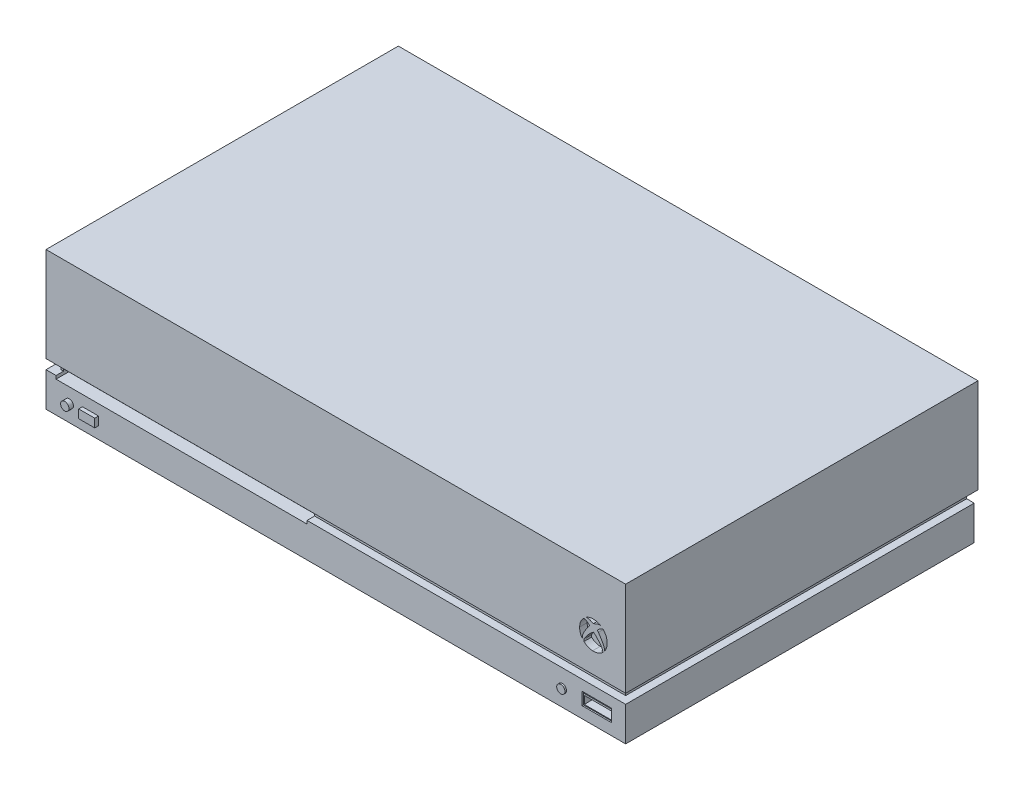
from build123d import *

# Parameters (mm, degrees)
SKETCH1_W                = 212.107853024
SKETCH1_H                = 117.102309081
BOSS_EXTRUDE1_DEPTH      = 31.75
SKETCH2_W                = 194.732937393
SKETCH2_H                = 117.102309081
BOSS_EXTRUDE2_DEPTH      = 14.732
SKETCH3_W                = 194.732937393
SKETCH3_H                = 3.216168398
CUT_EXTRUDE1_DEPTH       = 2.54
SKETCH4_W                = 117.102309081
SKETCH4_H                = 3.216168398
CUT_EXTRUDE2_DEPTH       = 2.54
SKETCH5_W                = 194.732937393
SKETCH5_H                = 3.216168398
CUT_EXTRUDE4_DEPTH       = 2.54
SKETCH6_W                = 112.022309081
SKETCH6_H                = 3.216168398
CUT_EXTRUDE6_DEPTH       = 2.54
SKETCH7_W                = 9.800841368
SKETCH7_H                = 4.210890985
CUT_EXTRUDE8_DEPTH       = 5.08
SKETCH8_W                = 9.800841368
SKETCH8_H                = 4.210890985
BOSS_EXTRUDE3_DEPTH      = 4.631427663
SKETCH9_W                = 9.384665973
SKETCH9_H                = 2.632296742
CUT_EXTRUDE9_DEPTH       = 4.631427663
SKETCH10_W               = 9.800841368
SKETCH10_H               = 0.718754899
CUT_EXTRUDE10_DEPTH      = 4.631427663
SKETCH11_R               = 1.397
BOSS_EXTRUDE4_DEPTH      = 0.508
SKETCH13_R               = 1.397
BOSS_EXTRUDE5_DEPTH      = 1.524
SKETCH14_W               = 84.322597194
SKETCH14_H               = 1.073519387
CUT_EXTRUDE12_DEPTH      = 12.7
SKETCH15_W               = 84.322597194
SKETCH15_H               = 0.3048
CUT_EXTRUDE14_DEPTH      = 10.16
SKETCH17_W               = 5.386365849
SKETCH17_H               = 2.851092169
BOSS_EXTRUDE7_DEPTH      = 1.27
SKETCH19_W               = 9.105647215
SKETCH19_H               = 31.75
CUT_EXTRUDE17_DEPTH      = 133.35
SKETCH20_W               = 84.322597194
SKETCH20_H               = 0.343473221
CUT_EXTRUDE20_DEPTH      = 10.16
SKETCH21_W               = 189.652937393
SKETCH21_H               = 3.216168398
BOSS_EXTRUDE8_DEPTH      = 2.54
BOSS_EXTRUDE9_DEPTH      = 1.27
SKETCH25_R               = 0.951460687
SKETCH25_R_2             = 0.889
CUT_EXTRUDE23_DEPTH      = 13.97
CUT_EXTRUDE28_DEPTH      = 13.97
SKETCH27_W               = 7.363051664
SKETCH27_H               = 3.420256256
CUT_EXTRUDE29_DEPTH      = 13.97
SKETCH28_R               = 3.898786899
SKETCH28_R_2             = 2.556322344
SKETCH28_W               = 12.142531133
SKETCH28_H               = 6.109787609
SKETCH28_W_2             = 8.308047617
SKETCH28_H_2             = 10.526669927
SKETCH28_W_3             = 10.012262514
CUT_EXTRUDE30_DEPTH      = 7.62
SKETCH30_R               = 1.014601812
SKETCH30_R_2             = 1.106611033
SKETCH30_W               = 0.071233975
SKETCH30_H               = 0.79375
BOSS_EXTRUDE10_DEPTH     = 3.81
CUT_EXTRUDE33_DEPTH      = 2.54
CUT_EXTRUDE34_DEPTH      = 130.048
CUT_EXTRUDE34_DEPTH_BACK = 66.548


with BuildPart() as part:
    # Sketch1 → Boss-Extrude1 (new body)
    with BuildSketch(Plane(origin=(0, 0, 0), x_dir=(1, 0, 0), z_dir=(0, 1, 0))):
        with Locations((31.316249479, -18.517517006)):
            Rectangle(SKETCH1_W, SKETCH1_H)
    extrude(amount=BOSS_EXTRUDE1_DEPTH)

    # Sketch2 → Boss-Extrude2 (add)
    with BuildSketch(Plane.XZ):
        with Locations((40.003707294, 18.517517006)):
            Rectangle(SKETCH2_W, SKETCH2_H)
    extrude(amount=BOSS_EXTRUDE2_DEPTH)

    # Sketch3 → Cut-Extrude1 (cut)
    with BuildSketch(Plane.XY.offset(77.068671546)):
        with Locations((40.003707294, -1.608084199)):
            Rectangle(SKETCH3_W, SKETCH3_H)
    extrude(amount=-CUT_EXTRUDE1_DEPTH, mode=Mode.SUBTRACT)

    # Sketch4 → Cut-Extrude2 (cut)
    with BuildSketch(Plane(origin=(137.370175991, 0, 0), x_dir=(0, 0, -1), z_dir=(1, 0, 0))):
        with Locations((-18.517517006, -1.608084199)):
            Rectangle(SKETCH4_W, SKETCH4_H)
    extrude(amount=-CUT_EXTRUDE2_DEPTH, mode=Mode.SUBTRACT)

    # Sketch5 → Cut-Extrude4 (cut)
    with BuildSketch(Plane(origin=(0, 0, -40.033637535), x_dir=(-1, 0, 0), z_dir=(0, 0, -1))):
        with Locations((-40.003707294, -1.608084199)):
            Rectangle(SKETCH5_W, SKETCH5_H)
    extrude(amount=-CUT_EXTRUDE4_DEPTH, mode=Mode.SUBTRACT)

    # Sketch6 → Cut-Extrude6 (cut)
    with BuildSketch(Plane.ZY.offset(57.362761402)):
        with Locations((18.517517005, -1.608084199)):
            Rectangle(SKETCH6_W, SKETCH6_H)
    extrude(amount=-CUT_EXTRUDE6_DEPTH, mode=Mode.SUBTRACT)

    # Sketch7 → Cut-Extrude8 (cut)
    with BuildSketch(Plane.XY.offset(77.068671546)):
        with Locations((127.643755307, -8.816554508)):
            Rectangle(SKETCH7_W, SKETCH7_H)
    extrude(amount=-CUT_EXTRUDE8_DEPTH, mode=Mode.SUBTRACT)

    # Sketch8 → Boss-Extrude3 (add)
    with BuildSketch(Plane.XY.offset(71.988671546)):
        with Locations((127.643755307, -8.816554508)):
            Rectangle(SKETCH8_W, SKETCH8_H)
    extrude(amount=BOSS_EXTRUDE3_DEPTH)

    # Sketch9 → Cut-Extrude9 (cut)
    with BuildSketch(Plane.XY.offset(76.620099209)):
        with Locations((127.71617797, -9.310101698)):
            Rectangle(SKETCH9_W, SKETCH9_H)
    extrude(amount=-CUT_EXTRUDE9_DEPTH, mode=Mode.SUBTRACT)

    # Sketch10 → Cut-Extrude10 (cut)
    with BuildSketch(Plane.XY.offset(76.620099209)):
        with Locations((127.643755307, -7.070486465)):
            Rectangle(SKETCH10_W, SKETCH10_H)
    extrude(amount=-CUT_EXTRUDE10_DEPTH, mode=Mode.SUBTRACT)

    # Sketch11 → Boss-Extrude4 (add)
    with BuildSketch(Plane.XY.offset(77.068671546)):
        with Locations((116.100210308, -9.166079984)):
            Circle(SKETCH11_R)
    extrude(amount=BOSS_EXTRUDE4_DEPTH)

    # Sketch13 → Boss-Extrude5 (add)
    with BuildSketch(Plane.XY.offset(77.068671546)):
        with Locations((-49.539463299, -9.166079984)):
            Circle(SKETCH13_R)
    extrude(amount=BOSS_EXTRUDE5_DEPTH)

    # Sketch14 → Cut-Extrude12 (cut)
    with BuildSketch(Plane.XY.offset(77.068671546)):
        with Locations((-11.829077968, -3.752928092)):
            Rectangle(SKETCH14_W, SKETCH14_H)
    extrude(amount=-CUT_EXTRUDE12_DEPTH, mode=Mode.SUBTRACT)

    # Sketch15 → Cut-Extrude14 (cut)
    with BuildSketch(Plane.XY.offset(74.528671546)):
        with Locations((-11.829077968, -3.063768398)):
            Rectangle(SKETCH15_W, SKETCH15_H)
    extrude(amount=-CUT_EXTRUDE14_DEPTH, mode=Mode.SUBTRACT)

    # Sketch17 → Boss-Extrude7 (add)
    with BuildSketch(Plane.XY.offset(77.068671546)):
        with Locations((-42.420893341, -9.292123727)):
            Rectangle(SKETCH17_W, SKETCH17_H)
    extrude(amount=BOSS_EXTRUDE7_DEPTH)

    # Sketch19 → Cut-Extrude17 (cut)
    with BuildSketch(Plane.XY.offset(77.068671546)):
        with Locations((-70.184853426, 15.875)):
            Rectangle(SKETCH19_W, SKETCH19_H)
    extrude(amount=-CUT_EXTRUDE17_DEPTH, mode=Mode.SUBTRACT)

    # Sketch20 → Cut-Extrude20 (cut)
    with BuildSketch(Plane.XY.offset(74.528671546)):
        with Locations((-11.829077968, -2.739631788)):
            Rectangle(SKETCH20_W, SKETCH20_H)
    extrude(amount=-CUT_EXTRUDE20_DEPTH, mode=Mode.SUBTRACT)

    # Sketch21 → Boss-Extrude8 (add)
    with BuildSketch(Plane(origin=(0, 0, -37.493637535), x_dir=(-1, 0, 0), z_dir=(0, 0, -1))):
        with Locations((-40.003707295, -1.608084199)):
            Rectangle(SKETCH21_W, SKETCH21_H)
    extrude(amount=BOSS_EXTRUDE8_DEPTH)

    # Sketch24 → Boss-Extrude9 (add)
    with BuildSketch(Plane(origin=(0, 0, -40.033637535), x_dir=(-1, 0, 0), z_dir=(0, 0, -1))):
        Polygon((-135.338175991, 29.718), (63.600029818, 29.718), (63.600029818, 0), (65.632029818, 0), (65.632029818, 31.75), (-137.370175991, 31.75), (-137.370175991, 0), (-135.338175991, 0), align=None)
    extrude(amount=BOSS_EXTRUDE9_DEPTH)

    # Sketch25 → Cut-Extrude23 (cut)
    with BuildSketch(Plane(origin=(0, 0, -40.033637535), x_dir=(-1, 0, 0), z_dir=(0, 0, -1))):
        with Locations((-131.916024843, 26.659235371)):
            Circle(SKETCH25_R)
        with Locations((-129.376024843, 26.659235371)):
            Circle(SKETCH25_R)
        with Locations((-126.836024843, 26.659235371)):
            Circle(SKETCH25_R)
        with Locations((-124.296024843, 26.659235371)):
            Circle(SKETCH25_R)
        with Locations((-121.756024843, 26.659235371)):
            Circle(SKETCH25_R)
        with Locations((-119.216024843, 26.659235371)):
            Circle(SKETCH25_R)
        with Locations((-116.676024843, 26.659235371)):
            Circle(SKETCH25_R)
        with Locations((-114.136024843, 26.659235371)):
            Circle(SKETCH25_R)
        with Locations((-111.596024843, 26.659235371)):
            Circle(SKETCH25_R)
        with Locations((-109.056024843, 26.659235371)):
            Circle(SKETCH25_R)
        with Locations((-106.516024843, 26.659235371)):
            Circle(SKETCH25_R)
        with Locations((-103.976024843, 26.659235371)):
            Circle(SKETCH25_R)
        with Locations((-101.436024843, 26.659235371)):
            Circle(SKETCH25_R)
        with Locations((-98.896024843, 26.659235371)):
            Circle(SKETCH25_R)
        with Locations((-96.356024843, 26.659235371)):
            Circle(SKETCH25_R)
        with Locations((-93.816024843, 26.659235371)):
            Circle(SKETCH25_R)
        with Locations((-91.276024843, 26.659235371)):
            Circle(SKETCH25_R)
        with Locations((-88.736024843, 26.659235371)):
            Circle(SKETCH25_R)
        with Locations((-86.196024843, 26.659235371)):
            Circle(SKETCH25_R)
        with Locations((-83.656024843, 26.659235371)):
            Circle(SKETCH25_R)
        with Locations((-81.116024843, 26.659235371)):
            Circle(SKETCH25_R)
        with Locations((-78.576024843, 26.659235371)):
            Circle(SKETCH25_R)
        with Locations((-76.036024843, 26.659235371)):
            Circle(SKETCH25_R)
        with Locations((-73.496024843, 26.659235371)):
            Circle(SKETCH25_R)
        with Locations((-70.956024843, 26.659235371)):
            Circle(SKETCH25_R)
        with Locations((-68.416024843, 26.659235371)):
            Circle(SKETCH25_R)
        with Locations((-65.876024843, 26.659235371)):
            Circle(SKETCH25_R)
        with Locations((-63.336024843, 26.659235371)):
            Circle(SKETCH25_R)
        with Locations((-60.796024843, 26.659235371)):
            Circle(SKETCH25_R)
        with Locations((-58.256024843, 26.659235371)):
            Circle(SKETCH25_R)
        with Locations((-55.716024843, 26.659235371)):
            Circle(SKETCH25_R)
        with Locations((-53.176024843, 26.659235371)):
            Circle(SKETCH25_R)
        with Locations((-50.636024843, 26.659235371)):
            Circle(SKETCH25_R)
        with Locations((-48.096024843, 26.659235371)):
            Circle(SKETCH25_R)
        with Locations((-45.556024843, 26.659235371)):
            Circle(SKETCH25_R)
        with Locations((-43.016024843, 26.659235371)):
            Circle(SKETCH25_R)
        with Locations((-40.476024843, 26.659235371)):
            Circle(SKETCH25_R)
        with Locations((-37.936024843, 26.659235371)):
            Circle(SKETCH25_R)
        with Locations((-35.396024843, 26.659235371)):
            Circle(SKETCH25_R)
        with Locations((-32.856024843, 26.659235371)):
            Circle(SKETCH25_R)
        with Locations((-30.316024843, 26.659235371)):
            Circle(SKETCH25_R)
        with Locations((-27.776024843, 26.659235371)):
            Circle(SKETCH25_R)
        with Locations((-25.236024843, 26.659235371)):
            Circle(SKETCH25_R)
        with Locations((-22.696024843, 26.659235371)):
            Circle(SKETCH25_R)
        with Locations((-20.156024843, 26.659235371)):
            Circle(SKETCH25_R)
        with Locations((-17.616024843, 26.659235371)):
            Circle(SKETCH25_R)
        with Locations((-15.076024843, 26.659235371)):
            Circle(SKETCH25_R)
        with Locations((-12.536024843, 26.659235371)):
            Circle(SKETCH25_R)
        with Locations((-9.996024843, 26.659235371)):
            Circle(SKETCH25_R)
        with Locations((-7.456024843, 26.659235371)):
            Circle(SKETCH25_R)
        with Locations((-4.916024843, 26.659235371)):
            Circle(SKETCH25_R)
        with Locations((-2.376024843, 26.659235371)):
            Circle(SKETCH25_R)
        with Locations((0.163975157, 26.659235371)):
            Circle(SKETCH25_R)
        with Locations((2.703975157, 26.659235371)):
            Circle(SKETCH25_R)
        with Locations((5.243975157, 26.659235371)):
            Circle(SKETCH25_R)
        with Locations((7.783975157, 26.659235371)):
            Circle(SKETCH25_R)
        with Locations((10.323975157, 26.659235371)):
            Circle(SKETCH25_R)
        with Locations((12.863975157, 26.659235371)):
            Circle(SKETCH25_R)
        with Locations((15.403975157, 26.659235371)):
            Circle(SKETCH25_R)
        with Locations((17.943975157, 26.659235371)):
            Circle(SKETCH25_R)
        with Locations((20.483975157, 26.659235371)):
            Circle(SKETCH25_R)
        with Locations((23.023975157, 26.659235371)):
            Circle(SKETCH25_R)
        with Locations((25.563975157, 26.659235371)):
            Circle(SKETCH25_R)
        with Locations((-131.916024843, 24.119235371)):
            Circle(SKETCH25_R_2)
        with Locations((-129.376024843, 24.119235371)):
            Circle(SKETCH25_R_2)
        with Locations((-126.836024843, 24.119235371)):
            Circle(SKETCH25_R_2)
        with Locations((-124.296024843, 24.119235371)):
            Circle(SKETCH25_R_2)
        with Locations((-121.756024843, 24.119235371)):
            Circle(SKETCH25_R_2)
        with Locations((-119.216024843, 24.119235371)):
            Circle(SKETCH25_R_2)
        with Locations((-116.676024843, 24.119235371)):
            Circle(SKETCH25_R_2)
        with Locations((-114.136024843, 24.119235371)):
            Circle(SKETCH25_R_2)
        with Locations((-111.596024843, 24.119235371)):
            Circle(SKETCH25_R_2)
        with Locations((-109.056024843, 24.119235371)):
            Circle(SKETCH25_R_2)
        with Locations((-106.516024843, 24.119235371)):
            Circle(SKETCH25_R_2)
        with Locations((-103.976024843, 24.119235371)):
            Circle(SKETCH25_R_2)
        with Locations((-101.436024843, 24.119235371)):
            Circle(SKETCH25_R_2)
        with Locations((-98.896024843, 24.119235371)):
            Circle(SKETCH25_R_2)
        with Locations((-96.356024843, 24.119235371)):
            Circle(SKETCH25_R_2)
        with Locations((-93.816024843, 24.119235371)):
            Circle(SKETCH25_R_2)
        with Locations((-91.276024843, 24.119235371)):
            Circle(SKETCH25_R_2)
        with Locations((-88.736024843, 24.119235371)):
            Circle(SKETCH25_R_2)
        with Locations((-86.196024843, 24.119235371)):
            Circle(SKETCH25_R_2)
        with Locations((-83.656024843, 24.119235371)):
            Circle(SKETCH25_R_2)
        with Locations((-81.116024843, 24.119235371)):
            Circle(SKETCH25_R_2)
        with Locations((-78.576024843, 24.119235371)):
            Circle(SKETCH25_R_2)
        with Locations((-76.036024843, 24.119235371)):
            Circle(SKETCH25_R_2)
        with Locations((-73.496024843, 24.119235371)):
            Circle(SKETCH25_R_2)
        with Locations((-70.956024843, 24.119235371)):
            Circle(SKETCH25_R_2)
        with Locations((-68.416024843, 24.119235371)):
            Circle(SKETCH25_R_2)
        with Locations((-65.876024843, 24.119235371)):
            Circle(SKETCH25_R_2)
        with Locations((-63.336024843, 24.119235371)):
            Circle(SKETCH25_R_2)
        with Locations((-60.796024843, 24.119235371)):
            Circle(SKETCH25_R_2)
        with Locations((-58.256024843, 24.119235371)):
            Circle(SKETCH25_R_2)
        with Locations((-55.716024843, 24.119235371)):
            Circle(SKETCH25_R_2)
        with Locations((-53.176024843, 24.119235371)):
            Circle(SKETCH25_R_2)
        with Locations((-50.636024843, 24.119235371)):
            Circle(SKETCH25_R_2)
        with Locations((-48.096024843, 24.119235371)):
            Circle(SKETCH25_R_2)
        with Locations((-45.556024843, 24.119235371)):
            Circle(SKETCH25_R_2)
        with Locations((-43.016024843, 24.119235371)):
            Circle(SKETCH25_R_2)
        with Locations((-40.476024843, 24.119235371)):
            Circle(SKETCH25_R_2)
        with Locations((-37.936024843, 24.119235371)):
            Circle(SKETCH25_R_2)
        with Locations((-35.396024843, 24.119235371)):
            Circle(SKETCH25_R_2)
        with Locations((-32.856024843, 24.119235371)):
            Circle(SKETCH25_R_2)
        with Locations((-30.316024843, 24.119235371)):
            Circle(SKETCH25_R_2)
        with Locations((-27.776024843, 24.119235371)):
            Circle(SKETCH25_R_2)
        with Locations((-25.236024843, 24.119235371)):
            Circle(SKETCH25_R_2)
        with Locations((-22.696024843, 24.119235371)):
            Circle(SKETCH25_R_2)
        with Locations((-20.156024843, 24.119235371)):
            Circle(SKETCH25_R_2)
        with Locations((-17.616024843, 24.119235371)):
            Circle(SKETCH25_R_2)
        with Locations((-15.076024843, 24.119235371)):
            Circle(SKETCH25_R_2)
        with Locations((-12.536024843, 24.119235371)):
            Circle(SKETCH25_R_2)
        with Locations((-9.996024843, 24.119235371)):
            Circle(SKETCH25_R_2)
        with Locations((-7.456024843, 24.119235371)):
            Circle(SKETCH25_R_2)
        with Locations((-4.916024843, 24.119235371)):
            Circle(SKETCH25_R_2)
        with Locations((-2.376024843, 24.119235371)):
            Circle(SKETCH25_R_2)
        with Locations((0.163975157, 24.119235371)):
            Circle(SKETCH25_R_2)
        with Locations((2.703975157, 24.119235371)):
            Circle(SKETCH25_R_2)
        with Locations((5.243975157, 24.119235371)):
            Circle(SKETCH25_R_2)
        with Locations((7.783975157, 24.119235371)):
            Circle(SKETCH25_R_2)
        with Locations((10.323975157, 24.119235371)):
            Circle(SKETCH25_R_2)
        with Locations((12.863975157, 24.119235371)):
            Circle(SKETCH25_R_2)
        with Locations((15.403975157, 24.119235371)):
            Circle(SKETCH25_R_2)
        with Locations((17.943975157, 24.119235371)):
            Circle(SKETCH25_R_2)
        with Locations((20.483975157, 24.119235371)):
            Circle(SKETCH25_R_2)
        with Locations((23.023975157, 24.119235371)):
            Circle(SKETCH25_R_2)
        with Locations((25.563975157, 24.119235371)):
            Circle(SKETCH25_R_2)
        with Locations((-131.916024843, 21.579235371)):
            Circle(SKETCH25_R_2)
        with Locations((-129.376024843, 21.579235371)):
            Circle(SKETCH25_R_2)
        with Locations((-126.836024843, 21.579235371)):
            Circle(SKETCH25_R_2)
        with Locations((-124.296024843, 21.579235371)):
            Circle(SKETCH25_R_2)
        with Locations((-121.756024843, 21.579235371)):
            Circle(SKETCH25_R_2)
        with Locations((-119.216024843, 21.579235371)):
            Circle(SKETCH25_R_2)
        with Locations((-116.676024843, 21.579235371)):
            Circle(SKETCH25_R_2)
        with Locations((-114.136024843, 21.579235371)):
            Circle(SKETCH25_R_2)
        with Locations((-111.596024843, 21.579235371)):
            Circle(SKETCH25_R_2)
        with Locations((-109.056024843, 21.579235371)):
            Circle(SKETCH25_R_2)
        with Locations((-106.516024843, 21.579235371)):
            Circle(SKETCH25_R_2)
        with Locations((-103.976024843, 21.579235371)):
            Circle(SKETCH25_R_2)
        with Locations((-101.436024843, 21.579235371)):
            Circle(SKETCH25_R_2)
        with Locations((-98.896024843, 21.579235371)):
            Circle(SKETCH25_R_2)
        with Locations((-96.356024843, 21.579235371)):
            Circle(SKETCH25_R_2)
        with Locations((-93.816024843, 21.579235371)):
            Circle(SKETCH25_R_2)
        with Locations((-91.276024843, 21.579235371)):
            Circle(SKETCH25_R_2)
        with Locations((-88.736024843, 21.579235371)):
            Circle(SKETCH25_R_2)
        with Locations((-86.196024843, 21.579235371)):
            Circle(SKETCH25_R_2)
        with Locations((-83.656024843, 21.579235371)):
            Circle(SKETCH25_R_2)
        with Locations((-81.116024843, 21.579235371)):
            Circle(SKETCH25_R_2)
        with Locations((-78.576024843, 21.579235371)):
            Circle(SKETCH25_R_2)
        with Locations((-76.036024843, 21.579235371)):
            Circle(SKETCH25_R_2)
        with Locations((-73.496024843, 21.579235371)):
            Circle(SKETCH25_R_2)
        with Locations((-70.956024843, 21.579235371)):
            Circle(SKETCH25_R_2)
        with Locations((-68.416024843, 21.579235371)):
            Circle(SKETCH25_R_2)
        with Locations((-65.876024843, 21.579235371)):
            Circle(SKETCH25_R_2)
        with Locations((-63.336024843, 21.579235371)):
            Circle(SKETCH25_R_2)
        with Locations((-60.796024843, 21.579235371)):
            Circle(SKETCH25_R_2)
        with Locations((-58.256024843, 21.579235371)):
            Circle(SKETCH25_R_2)
        with Locations((-55.716024843, 21.579235371)):
            Circle(SKETCH25_R_2)
        with Locations((-53.176024843, 21.579235371)):
            Circle(SKETCH25_R_2)
        with Locations((-50.636024843, 21.579235371)):
            Circle(SKETCH25_R_2)
        with Locations((-48.096024843, 21.579235371)):
            Circle(SKETCH25_R_2)
        with Locations((-45.556024843, 21.579235371)):
            Circle(SKETCH25_R_2)
        with Locations((-43.016024843, 21.579235371)):
            Circle(SKETCH25_R_2)
        with Locations((-40.476024843, 21.579235371)):
            Circle(SKETCH25_R_2)
        with Locations((-37.936024843, 21.579235371)):
            Circle(SKETCH25_R_2)
        with Locations((-35.396024843, 21.579235371)):
            Circle(SKETCH25_R_2)
        with Locations((-32.856024843, 21.579235371)):
            Circle(SKETCH25_R_2)
        with Locations((-30.316024843, 21.579235371)):
            Circle(SKETCH25_R_2)
        with Locations((-27.776024843, 21.579235371)):
            Circle(SKETCH25_R_2)
        with Locations((-25.236024843, 21.579235371)):
            Circle(SKETCH25_R_2)
        with Locations((-22.696024843, 21.579235371)):
            Circle(SKETCH25_R_2)
        with Locations((-20.156024843, 21.579235371)):
            Circle(SKETCH25_R_2)
        with Locations((-17.616024843, 21.579235371)):
            Circle(SKETCH25_R_2)
        with Locations((-15.076024843, 21.579235371)):
            Circle(SKETCH25_R_2)
        with Locations((-12.536024843, 21.579235371)):
            Circle(SKETCH25_R_2)
        with Locations((-9.996024843, 21.579235371)):
            Circle(SKETCH25_R_2)
        with Locations((-7.456024843, 21.579235371)):
            Circle(SKETCH25_R_2)
        with Locations((-4.916024843, 21.579235371)):
            Circle(SKETCH25_R_2)
        with Locations((-2.376024843, 21.579235371)):
            Circle(SKETCH25_R_2)
        with Locations((0.163975157, 21.579235371)):
            Circle(SKETCH25_R_2)
        with Locations((2.703975157, 21.579235371)):
            Circle(SKETCH25_R_2)
        with Locations((5.243975157, 21.579235371)):
            Circle(SKETCH25_R_2)
        with Locations((7.783975157, 21.579235371)):
            Circle(SKETCH25_R_2)
        with Locations((10.323975157, 21.579235371)):
            Circle(SKETCH25_R_2)
        with Locations((12.863975157, 21.579235371)):
            Circle(SKETCH25_R_2)
        with Locations((15.403975157, 21.579235371)):
            Circle(SKETCH25_R_2)
        with Locations((17.943975157, 21.579235371)):
            Circle(SKETCH25_R_2)
        with Locations((20.483975157, 21.579235371)):
            Circle(SKETCH25_R_2)
        with Locations((23.023975157, 21.579235371)):
            Circle(SKETCH25_R_2)
        with Locations((25.563975157, 21.579235371)):
            Circle(SKETCH25_R_2)
        with Locations((-131.916024843, 19.039235371)):
            Circle(SKETCH25_R_2)
        with Locations((-129.376024843, 19.039235371)):
            Circle(SKETCH25_R_2)
        with Locations((-126.836024843, 19.039235371)):
            Circle(SKETCH25_R_2)
        with Locations((-124.296024843, 19.039235371)):
            Circle(SKETCH25_R_2)
        with Locations((-121.756024843, 19.039235371)):
            Circle(SKETCH25_R_2)
        with Locations((-119.216024843, 19.039235371)):
            Circle(SKETCH25_R_2)
        with Locations((-116.676024843, 19.039235371)):
            Circle(SKETCH25_R_2)
        with Locations((-114.136024843, 19.039235371)):
            Circle(SKETCH25_R_2)
        with Locations((-111.596024843, 19.039235371)):
            Circle(SKETCH25_R_2)
        with Locations((-109.056024843, 19.039235371)):
            Circle(SKETCH25_R_2)
        with Locations((-106.516024843, 19.039235371)):
            Circle(SKETCH25_R_2)
        with Locations((-103.976024843, 19.039235371)):
            Circle(SKETCH25_R_2)
        with Locations((-101.436024843, 19.039235371)):
            Circle(SKETCH25_R_2)
        with Locations((-98.896024843, 19.039235371)):
            Circle(SKETCH25_R_2)
        with Locations((-96.356024843, 19.039235371)):
            Circle(SKETCH25_R_2)
        with Locations((-93.816024843, 19.039235371)):
            Circle(SKETCH25_R_2)
        with Locations((-91.276024843, 19.039235371)):
            Circle(SKETCH25_R_2)
        with Locations((-88.736024843, 19.039235371)):
            Circle(SKETCH25_R_2)
        with Locations((-86.196024843, 19.039235371)):
            Circle(SKETCH25_R_2)
        with Locations((-83.656024843, 19.039235371)):
            Circle(SKETCH25_R_2)
        with Locations((-81.116024843, 19.039235371)):
            Circle(SKETCH25_R_2)
        with Locations((-78.576024843, 19.039235371)):
            Circle(SKETCH25_R_2)
        with Locations((-76.036024843, 19.039235371)):
            Circle(SKETCH25_R_2)
        with Locations((-73.496024843, 19.039235371)):
            Circle(SKETCH25_R_2)
        with Locations((-70.956024843, 19.039235371)):
            Circle(SKETCH25_R_2)
        with Locations((-68.416024843, 19.039235371)):
            Circle(SKETCH25_R_2)
        with Locations((-65.876024843, 19.039235371)):
            Circle(SKETCH25_R_2)
        with Locations((-63.336024843, 19.039235371)):
            Circle(SKETCH25_R_2)
        with Locations((-60.796024843, 19.039235371)):
            Circle(SKETCH25_R_2)
        with Locations((-58.256024843, 19.039235371)):
            Circle(SKETCH25_R_2)
        with Locations((-55.716024843, 19.039235371)):
            Circle(SKETCH25_R_2)
        with Locations((-53.176024843, 19.039235371)):
            Circle(SKETCH25_R_2)
        with Locations((-50.636024843, 19.039235371)):
            Circle(SKETCH25_R_2)
        with Locations((-48.096024843, 19.039235371)):
            Circle(SKETCH25_R_2)
        with Locations((-45.556024843, 19.039235371)):
            Circle(SKETCH25_R_2)
        with Locations((-43.016024843, 19.039235371)):
            Circle(SKETCH25_R_2)
        with Locations((-40.476024843, 19.039235371)):
            Circle(SKETCH25_R_2)
        with Locations((-37.936024843, 19.039235371)):
            Circle(SKETCH25_R_2)
        with Locations((-35.396024843, 19.039235371)):
            Circle(SKETCH25_R_2)
        with Locations((-32.856024843, 19.039235371)):
            Circle(SKETCH25_R_2)
        with Locations((-30.316024843, 19.039235371)):
            Circle(SKETCH25_R_2)
        with Locations((-27.776024843, 19.039235371)):
            Circle(SKETCH25_R_2)
        with Locations((-25.236024843, 19.039235371)):
            Circle(SKETCH25_R_2)
        with Locations((-22.696024843, 19.039235371)):
            Circle(SKETCH25_R_2)
        with Locations((-20.156024843, 19.039235371)):
            Circle(SKETCH25_R_2)
        with Locations((-17.616024843, 19.039235371)):
            Circle(SKETCH25_R_2)
        with Locations((-15.076024843, 19.039235371)):
            Circle(SKETCH25_R_2)
        with Locations((-12.536024843, 19.039235371)):
            Circle(SKETCH25_R_2)
        with Locations((-9.996024843, 19.039235371)):
            Circle(SKETCH25_R_2)
        with Locations((-7.456024843, 19.039235371)):
            Circle(SKETCH25_R_2)
        with Locations((-4.916024843, 19.039235371)):
            Circle(SKETCH25_R_2)
        with Locations((-2.376024843, 19.039235371)):
            Circle(SKETCH25_R_2)
        with Locations((0.163975157, 19.039235371)):
            Circle(SKETCH25_R_2)
        with Locations((2.703975157, 19.039235371)):
            Circle(SKETCH25_R_2)
        with Locations((5.243975157, 19.039235371)):
            Circle(SKETCH25_R_2)
        with Locations((7.783975157, 19.039235371)):
            Circle(SKETCH25_R_2)
        with Locations((10.323975157, 19.039235371)):
            Circle(SKETCH25_R_2)
        with Locations((12.863975157, 19.039235371)):
            Circle(SKETCH25_R_2)
        with Locations((15.403975157, 19.039235371)):
            Circle(SKETCH25_R_2)
        with Locations((17.943975157, 19.039235371)):
            Circle(SKETCH25_R_2)
        with Locations((20.483975157, 19.039235371)):
            Circle(SKETCH25_R_2)
        with Locations((23.023975157, 19.039235371)):
            Circle(SKETCH25_R_2)
        with Locations((25.563975157, 19.039235371)):
            Circle(SKETCH25_R_2)
    extrude(amount=-CUT_EXTRUDE23_DEPTH, mode=Mode.SUBTRACT)

    # Sketch26 → Cut-Extrude28 (cut)
    with BuildSketch(Plane(origin=(0, 0, -40.033637535), x_dir=(-1, 0, 0), z_dir=(0, 0, -1))):
        Polygon((28.992739722, 29.718), (28.992739722, 0), (54.822761402, 0), (54.822761402, -0.444247918), (28.464763768, -0.444247918), (28.464763768, 29.718), align=None)
    extrude(amount=-CUT_EXTRUDE28_DEPTH, mode=Mode.SUBTRACT)

    # Sketch27 → Cut-Extrude29 (cut)
    with BuildSketch(Plane(origin=(0, 0, -40.033637535), x_dir=(-1, 0, 0), z_dir=(0, 0, -1))):
        with Locations((47.253379976, 12.695028697)):
            Rectangle(SKETCH27_W, SKETCH27_H)
    extrude(amount=-CUT_EXTRUDE29_DEPTH, mode=Mode.SUBTRACT)

    # Sketch28 → Cut-Extrude30 (cut)
    # profile 1 of 8: a face of its own
    with BuildSketch(Plane(origin=(0, 0, -40.033637535), x_dir=(-1, 0, 0), z_dir=(0, 0, -1))):
        with Locations((-18.590021562, 4.585485569)):
            Circle(SKETCH28_R)
        with Locations((-18.590021562, 4.585485569)):
            Circle(SKETCH28_R_2, mode=Mode.SUBTRACT)
    # profile 2 of 8: a face of its own
    with BuildSketch(Plane(origin=(0, 0, -40.033637535), x_dir=(-1, 0, 0), z_dir=(0, 0, -1))):
        with BuildLine():
            Line((-126.65174084, 8.346351948), (-120.349990221, 8.346351948))
            ThreePointArc((-120.349990221, 8.346351948), (-117.04907323, 5.045434957), (-120.349990221, 1.744517967))
            Line((-120.349990221, 1.744517967), (-126.65174084, 1.744517967))
            ThreePointArc((-126.65174084, 1.744517967), (-129.952657831, 5.045434957), (-126.65174084, 8.346351948))
        make_face()
    # profile 3 of 8: a face of its own
    with BuildSketch(Plane(origin=(0, 0, -40.033637535), x_dir=(-1, 0, 0), z_dir=(0, 0, -1))):
        Polygon((-83.949875267, 4.585485569), (-86.79084287, 1.744517967), (-94.35990535, 1.744517967), (-96.495695349, 3.880307966), (-96.495695349, 7.854305576), (-83.949875267, 7.854305576), align=None)
    # profile 4 of 8: a face of its own
    with BuildSketch(Plane(origin=(0, 0, -40.033637535), x_dir=(-1, 0, 0), z_dir=(0, 0, -1))):
        Polygon((-65.308055184, 7.854305576), (-65.308055184, 4.585485569), (-68.149022787, 1.744517967), (-75.718085267, 1.744517967), (-77.853875267, 3.880307966), (-77.853875267, 7.854305576), align=None)
    # profile 5 of 8: a face of its own
    with BuildSketch(Plane(origin=(0, 0, -40.033637535), x_dir=(-1, 0, 0), z_dir=(0, 0, -1))):
        with Locations((-34.902258485, 4.799411772)):
            Rectangle(SKETCH28_W, SKETCH28_H)
    # profile 6 of 8: a face of its own
    with BuildSketch(Plane(origin=(0, 0, -40.033637535), x_dir=(-1, 0, 0), z_dir=(0, 0, -1))):
        with Locations((-53.140789618, 4.799411772)):
            Rectangle(SKETCH28_W, SKETCH28_H)
    # profile 7 of 8: a face of its own
    with BuildSketch(Plane(origin=(0, 0, -40.033637535), x_dir=(-1, 0, 0), z_dir=(0, 0, -1))):
        with Locations((-1.228332311, 5.263334964)):
            Rectangle(SKETCH28_W_2, SKETCH28_H_2)
    # profile 8 of 8: a face of its own
    with BuildSketch(Plane(origin=(0, 0, -40.033637535), x_dir=(-1, 0, 0), z_dir=(0, 0, -1))):
        with Locations((20.074353888, 5.263334964)):
            Rectangle(SKETCH28_W_3, SKETCH28_H_2)
    extrude(amount=-CUT_EXTRUDE30_DEPTH, mode=Mode.SUBTRACT)

    # Sketch30 → Boss-Extrude10 (add)
    # profile 1 of 7: a face of its own
    with BuildSketch(Plane(origin=(0, 0, -40.033637535), x_dir=(-1, 0, 0), z_dir=(0, 0, -1))):
        with BuildLine():
            Line((-126.65174084, 6.958816874), (-120.349990221, 6.958816874))
            ThreePointArc((-120.349990221, 6.958816874), (-118.436608304, 5.045434957), (-120.349990221, 3.13205304))
            Line((-120.349990221, 3.13205304), (-126.65174084, 3.13205304))
            ThreePointArc((-126.65174084, 3.13205304), (-128.565122757, 5.045434957), (-126.65174084, 6.958816874))
        make_face()
        with Locations((-126.65174084, 5.045434957)):
            Circle(SKETCH30_R, mode=Mode.SUBTRACT)
        with Locations((-120.349990221, 5.045434957)):
            Circle(SKETCH30_R_2, mode=Mode.SUBTRACT)
    # profile 2 of 7: a face of its own
    with BuildSketch(Plane(origin=(0, 0, -40.033637535), x_dir=(-1, 0, 0), z_dir=(0, 0, -1))):
        Polygon((-73.817339244, 15.03651706), (-73.74610527, 15.03651706), (-73.74610527, 14.710876035), (-73.339053988, 14.710876035), (-73.339053988, 15.03651706), (-73.267820014, 15.03651706), (-73.267820014, 14.24276706), (-73.339053988, 14.24276706), (-73.339053988, 14.629465778), (-73.74610527, 14.629465778), (-73.74610527, 14.24276706), (-73.817339244, 14.24276706), align=None)
    # profile 3 of 7: a face of its own
    with BuildSketch(Plane(origin=(0, 0, -40.033637535), x_dir=(-1, 0, 0), z_dir=(0, 0, -1))):
        with BuildLine():
            Line((-72.759005911, 14.24276706), (-72.759005911, 15.03651706))
            Line((-72.759005911, 15.03651706), (-72.598729469, 15.03651706))
            add(Edge.make_bspline(
                [(-72.598729469, 15.03651706), (-72.58478918, 15.036416692), (-72.557856616, 15.03622278), (-72.518937364, 15.034993286), (-72.482927475, 15.032818305), (-72.44994538, 15.029650217), (-72.419900534, 15.025760154), (-72.392877064, 15.020884169), (-72.368735239, 15.015126495), (-72.353887705, 15.010217616), (-72.346866488, 15.007896267)],
                knots=[0, 0, 0, 0, 1.314313732, 2.53924729, 3.670748893, 4.714932338, 5.66265055, 6.526160246, 7.303039223, 8, 8, 8, 8], degree=3))
            add(Edge.make_bspline(
                [(-72.346866488, 15.007896267), (-72.33768286, 15.004396803), (-72.319523857, 14.997477232), (-72.29366867, 14.984424285), (-72.269328811, 14.969634886), (-72.246373755, 14.953089538), (-72.225327853, 14.934319766), (-72.20536892, 14.914122892), (-72.187313438, 14.891764464), (-72.170778878, 14.867708172), (-72.155870969, 14.842237403), (-72.142912624, 14.815400691), (-72.132150737, 14.787334324), (-72.123216916, 14.758116353), (-72.116176023, 14.727682532), (-72.111372263, 14.695997423), (-72.108203842, 14.66318625), (-72.107885423, 14.640921684), (-72.10772386, 14.629624783)],
                knots=[0, 0, 0, 0, 0.984719456, 1.947108742, 2.898477687, 3.838006223, 4.779231079, 5.722358779, 6.681677486, 7.655904652, 8.64651281, 9.637519902, 10.640069247, 11.656948941, 12.698408672, 13.768548281, 14.867775369, 16, 16, 16, 16], degree=3))
            add(Edge.make_bspline(
                [(-72.10772386, 14.629624783), (-72.107866501, 14.619813752), (-72.108147589, 14.600480091), (-72.110671559, 14.57198653), (-72.114340117, 14.544338274), (-72.120019784, 14.517666981), (-72.126914639, 14.491738975), (-72.135751152, 14.466830591), (-72.145873845, 14.442713334), (-72.157678014, 14.419713299), (-72.170636864, 14.397922963), (-72.184543759, 14.377381727), (-72.199383867, 14.358382704), (-72.215298698, 14.340868358), (-72.232082591, 14.324865093), (-72.24984543, 14.310239225), (-72.26863305, 14.297276935), (-72.288361304, 14.285468859), (-72.309605712, 14.275168171), (-72.332768667, 14.266452794), (-72.357948952, 14.259230436), (-72.38508476, 14.253204537), (-72.414222977, 14.248424505), (-72.445392171, 14.245220841), (-72.478544453, 14.243054373), (-72.501309036, 14.242864691), (-72.513026093, 14.24276706)],
                knots=[0, 0, 0, 0, 1.105936401, 2.179363191, 3.223086493, 4.248585256, 5.251745608, 6.245858792, 7.225916811, 8.198733463, 9.158002045, 10.082870192, 10.993790845, 11.873723703, 12.748670949, 13.606408763, 14.465103618, 15.319838547, 16.196477973, 17.123216899, 18.106603292, 19.147568657, 20.255746949, 21.433717677, 22.679120308, 24, 24, 24, 24], degree=3))
            Line((-72.513026093, 14.24276706), (-72.759005911, 14.24276706))
        make_face()
        with BuildLine():
            Line((-72.687771937, 14.324177317), (-72.596662411, 14.324177317))
            add(Edge.make_bspline(
                [(-72.596662411, 14.324177317), (-72.583570442, 14.324233581), (-72.558389789, 14.324341799), (-72.522181636, 14.325291397), (-72.489098273, 14.326843051), (-72.459135002, 14.329014541), (-72.432308741, 14.331887602), (-72.408563427, 14.335090929), (-72.387976895, 14.339081779), (-72.375519683, 14.342699229), (-72.369763123, 14.344370876)],
                knots=[0, 0, 0, 0, 1.375205317, 2.645023457, 3.804390687, 4.853969522, 5.800190428, 6.637939096, 7.370582563, 8, 8, 8, 8], degree=3))
            add(Edge.make_bspline(
                [(-72.369763123, 14.344370876), (-72.36251769, 14.346922569), (-72.348199883, 14.351965007), (-72.327589351, 14.361162905), (-72.308367674, 14.372058161), (-72.290199864, 14.384169033), (-72.273343641, 14.39792268), (-72.257599243, 14.413020029), (-72.24299837, 14.429537916), (-72.229691875, 14.447455838), (-72.217783742, 14.466662274), (-72.207471517, 14.486968402), (-72.198433759, 14.508151733), (-72.191340221, 14.53053756), (-72.185780436, 14.553925757), (-72.181842373, 14.57831797), (-72.179389748, 14.603709642), (-72.17910367, 14.620979856), (-72.178957834, 14.629783787)],
                knots=[0, 0, 0, 0, 0.998632004, 1.973411704, 2.929992603, 3.868527914, 4.809262121, 5.754881198, 6.702106254, 7.672490631, 8.653608572, 9.636854334, 10.631411391, 11.644891563, 12.686317036, 13.754757253, 14.855430412, 16, 16, 16, 16], degree=3))
            add(Edge.make_bspline(
                [(-72.178957834, 14.629783787), (-72.17907424, 14.639066916), (-72.179302921, 14.657303704), (-72.182177274, 14.684062308), (-72.186377698, 14.709798098), (-72.192451856, 14.734512796), (-72.200192251, 14.758254619), (-72.209852108, 14.780892258), (-72.220889002, 14.802664791), (-72.234020651, 14.823069691), (-72.248402402, 14.842367593), (-72.264363099, 14.860046654), (-72.281649169, 14.876147147), (-72.300072072, 14.890919813), (-72.320151022, 14.903770325), (-72.341413019, 14.91526534), (-72.364169984, 14.92502073), (-72.380002506, 14.930209329), (-72.388048629, 14.932846187)],
                knots=[0, 0, 0, 0, 1.122418816, 2.205001699, 3.251619955, 4.274784885, 5.280384055, 6.268708349, 7.249350384, 8.229342522, 9.199999885, 10.157847722, 11.105861043, 12.055065948, 13.010012805, 13.98527497, 14.976112212, 16, 16, 16, 16], degree=3))
            add(Edge.make_bspline(
                [(-72.388048629, 14.932846187), (-72.39470505, 14.934686877), (-72.408858427, 14.938600688), (-72.431954162, 14.942870014), (-72.457947241, 14.946635677), (-72.486953066, 14.94982384), (-72.518938574, 14.9521115), (-72.553928364, 14.953828566), (-72.59193756, 14.954986677), (-72.618286099, 14.955065759), (-72.63196139, 14.955106804)],
                knots=[0, 0, 0, 0, 0.674548936, 1.434276114, 2.292660221, 3.240891867, 4.284742987, 5.42552168, 6.663806718, 8, 8, 8, 8], degree=3))
            Line((-72.63196139, 14.955106804), (-72.687771937, 14.955106804))
            Line((-72.687771937, 14.955106804), (-72.687771937, 14.324177317))
        make_face(mode=Mode.SUBTRACT)
    # profile 4 of 7: a face of its own
    with BuildSketch(Plane(origin=(0, 0, -40.033637535), x_dir=(-1, 0, 0), z_dir=(0, 0, -1))):
        Polygon((-71.680320014, 14.24276706), (-71.575536109, 15.03651706), (-71.565359827, 15.03651706), (-71.237651744, 14.385235009), (-70.910738683, 15.03651706), (-70.900403397, 15.03651706), (-70.794983475, 14.24276706), (-70.866535458, 14.24276706), (-70.942539565, 14.81391089), (-71.229065506, 14.24276706), (-71.245124951, 14.24276706), (-71.532763924, 14.815182926), (-71.608609026, 14.24276706), align=None)
    # profile 5 of 7: a face of its own
    with BuildSketch(Plane(origin=(0, 0, -40.033637535), x_dir=(-1, 0, 0), z_dir=(0, 0, -1))):
        with Locations((-70.291257513, 14.63964206)):
            Rectangle(SKETCH30_W, SKETCH30_H)
    # profile 6 of 7: a face of its own
    with BuildSketch(Plane(origin=(0, 0, -40.033637535), x_dir=(-1, 0, 0), z_dir=(0, 0, -1))):
        with Locations((-69.711209437, 14.63964206)):
            Rectangle(SKETCH30_W, SKETCH30_H)
    # profile 7 of 7: a face of its own
    with BuildSketch(Plane(origin=(0, 0, -40.033637535), x_dir=(-1, 0, 0), z_dir=(0, 0, -1))):
        Polygon((-69.472066808, 14.24276706), (-69.472066808, 15.03651706), (-69.457120394, 15.03651706), (-68.93272386, 14.411788745), (-68.93272386, 15.03651706), (-68.861489885, 15.03651706), (-68.861489885, 14.24276706), (-68.877708335, 14.24276706), (-69.400832834, 14.866064336), (-69.400832834, 14.24276706), align=None)
    extrude(amount=-BOSS_EXTRUDE10_DEPTH)


with BuildPart() as boss_extrude10_piece_1:
    # of the separate pieces the step leaves, piece 1, a body of its own (boss_extrude10_pieces)
    add(part.part.solids().sort_by_distance((135.338175991, 0, -40.033637535))[0])

    # Sketch31 → Cut-Extrude33 (cut)
    with BuildSketch(Plane.XY.offset(77.068671546)):
        with BuildLine():
            add(Edge.make_bspline(
                [(129.74169316, 14.858426009), (131.415675476, 13.365969774), (131.653206228, 10.435985815), (130.254444307, 8.688150895)],
                knots=[0, 0, 0, 0, 1, 1, 1, 1], degree=3))
            add(Edge.make_bspline(
                [(130.254444307, 8.688150895), (130.299966374, 9.013116075), (130.25156891, 9.339754981)],
                knots=[0, 0, 0, 1, 1, 1], degree=2))
            add(Edge.make_bspline(
                [(130.25156891, 9.339754981), (129.969929633, 10.768782891), (128.939608479, 11.952235868), (128.207436388, 13.156699269)],
                knots=[0, 0, 0, 0, 1, 1, 1, 1], degree=3))
            Line((128.207436388, 13.156699269), (127.834791476, 13.616480687))
            add(Edge.make_bspline(
                [(127.834791476, 13.616480687), (128.609066464, 14.519017183), (129.74169316, 14.858426009)],
                knots=[0, 0, 0, 1, 1, 1], degree=2))
        make_face()
        with BuildLine():
            add(Edge.make_bspline(
                [(125.232915195, 13.616480687), (124.482229664, 14.516985321), (123.386601459, 14.858426009)],
                knots=[0, 0, 0, 1, 1, 1], degree=2))
            add(Edge.make_bspline(
                [(123.386601459, 14.858426009), (121.94044756, 13.558435569), (121.919018747, 11.568691763)],
                knots=[0, 0, 0, 1, 1, 1], degree=2))
            add(Edge.make_bspline(
                [(121.919018747, 11.568691763), (121.87161883, 9.946570377), (122.824731624, 8.688150895)],
                knots=[0, 0, 0, 1, 1, 1], degree=2))
            add(Edge.make_bspline(
                [(122.824731624, 8.688150895), (122.72844842, 9.219258052), (122.917971429, 9.743080364)],
                knots=[0, 0, 0, 1, 1, 1], degree=2))
            add(Edge.make_bspline(
                [(122.917971429, 9.743080364), (123.213189536, 10.613020279), (123.709888179, 11.393424925)],
                knots=[0, 0, 0, 1, 1, 1], degree=2))
            add(Edge.make_bspline(
                [(123.709888179, 11.393424925), (124.366142472, 12.578817683), (125.232915195, 13.616480687)],
                knots=[0, 0, 0, 1, 1, 1], degree=2))
        make_face()
        with BuildLine():
            add(Edge.make_bspline(
                [(126.521271654, 14.839443693), (127.10498196, 15.122838045), (127.71297961, 15.350572513)],
                knots=[0, 0, 0, 1, 1, 1], degree=2))
            add(Edge.make_bspline(
                [(127.71297961, 15.350572513), (128.306328365, 15.589992154), (128.94313443, 15.50262836)],
                knots=[0, 0, 0, 1, 1, 1], degree=2))
            add(Edge.make_bspline(
                [(128.94313443, 15.50262836), (128.374008429, 15.851037596), (127.729301233, 16.015449817)],
                knots=[0, 0, 0, 1, 1, 1], degree=2))
            add(Edge.make_bspline(
                [(127.729301233, 16.015449817), (127.3882686, 16.128912115), (127.031338992, 16.144558631)],
                knots=[0, 0, 0, 1, 1, 1], degree=2))
            add(Edge.make_bspline(
                [(127.031338992, 16.144558631), (126.475395341, 16.193642667), (125.920188662, 16.134427466)],
                knots=[0, 0, 0, 1, 1, 1], degree=2))
            add(Edge.make_bspline(
                [(125.920188662, 16.134427466), (125.193485778, 16.052319375), (124.5355871, 15.731384726)],
                knots=[0, 0, 0, 1, 1, 1], degree=2))
            Line((124.5355871, 15.731384726), (124.245790398, 15.586486375))
            add(Edge.make_bspline(
                [(124.245790398, 15.586486375), (124.20503537, 15.563778624), (124.187383893, 15.519189587)],
                knots=[0, 0, 0, 1, 1, 1], degree=2))
            add(Edge.make_bspline(
                [(124.187383893, 15.519189587), (124.543129898, 15.540564295), (124.894758805, 15.485632902)],
                knots=[0, 0, 0, 1, 1, 1], degree=2))
            add(Edge.make_bspline(
                [(124.894758805, 15.485632902), (125.74606533, 15.261655582), (126.521271654, 14.839443693)],
                knots=[0, 0, 0, 1, 1, 1], degree=2))
        make_face()
        with BuildLine():
            add(Edge.make_bspline(
                [(126.521271654, 12.395878805), (126.607734991, 12.385074175), (126.673502681, 12.324178187)],
                knots=[0, 0, 0, 1, 1, 1], degree=2))
            add(Edge.make_bspline(
                [(126.673502681, 12.324178187), (127.918348286, 11.231912391), (128.94313443, 9.932200421)],
                knots=[0, 0, 0, 1, 1, 1], degree=2))
            add(Edge.make_bspline(
                [(128.94313443, 9.932200421), (129.567835991, 9.087866524), (129.74169316, 8.073438626)],
                knots=[0, 0, 0, 1, 1, 1], degree=2))
            add(Edge.make_bspline(
                [(129.74169316, 8.073438626), (128.273675869, 6.781107084), (126.265365176, 6.825897413)],
                knots=[0, 0, 0, 1, 1, 1], degree=2))
            add(Edge.make_bspline(
                [(126.265365176, 6.825897413), (124.613679412, 6.929264317), (123.386601459, 8.073438626)],
                knots=[0, 0, 0, 1, 1, 1], degree=2))
            add(Edge.make_bspline(
                [(123.386601459, 8.073438626), (123.229283471, 8.664218209), (123.611195103, 9.175226796)],
                knots=[0, 0, 0, 1, 1, 1], degree=2))
            add(Edge.make_bspline(
                [(123.611195103, 9.175226796), (124.766381145, 11.055739273), (126.521271654, 12.395878805)],
                knots=[0, 0, 0, 1, 1, 1], degree=2))
        make_face()
    extrude(amount=-CUT_EXTRUDE33_DEPTH, mode=Mode.SUBTRACT)

    # Sketch32 → Cut-Extrude34 (cut, two sides: drawn at the far end of the back side and taken through both)
    with BuildSketch(Plane.XY.offset(-CUT_EXTRUDE34_DEPTH_BACK)):
        Polygon((-57.362761402, -3.216168398), (-57.362761402, 44.227472656), (-72.215821864, 44.227472656), (-72.215821864, -3.216168398), (-59.203144093, -3.216168398), align=None)
    extrude(amount=CUT_EXTRUDE34_DEPTH + CUT_EXTRUDE34_DEPTH_BACK, mode=Mode.SUBTRACT)


with BuildPart() as boss_extrude10_piece_2:
    # of the separate pieces the step leaves, piece 2, a body of its own (boss_extrude10_pieces)
    add(part.part.solids().sort_by_distance((120.349990221, 6.958816874, -40.033637535))[0])


solid = Compound([boss_extrude10_piece_1.part, boss_extrude10_piece_2.part])
